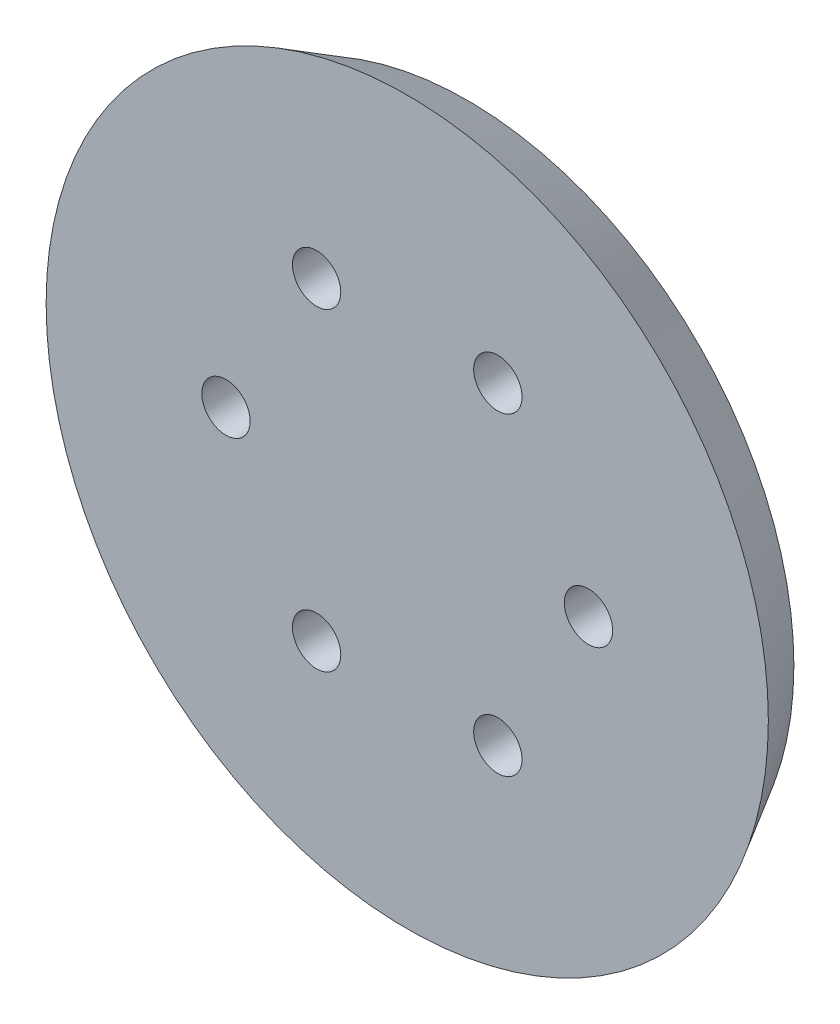
from build123d import *

# Parameters (mm, degrees)
SKETCH1_R           = 76.2
SKETCH1_R_2         = 5.08
BOSS_EXTRUDE1_DEPTH = 12.7
CHAMFER1_SIZE       = 13.198227154
CHAMFER1_SIZE_2     = 7.62
SKETCH3_R           = 5.08
BOSS_EXTRUDE2_DEPTH = 2.54
SKETCH4_R           = 4.064
BOSS_EXTRUDE3_DEPTH = 1.27
SKETCH5_R           = 4.572
BOSS_EXTRUDE4_DEPTH = 6.35


with BuildPart() as part:
    # Sketch1 → Boss-Extrude1 (new body)
    with BuildSketch(Plane.XY):
        Circle(SKETCH1_R)
        with Locations((38.1, 0)):
            Circle(SKETCH1_R_2, mode=Mode.SUBTRACT)
        with Locations((19.05, -32.995567884)):
            Circle(SKETCH1_R_2, mode=Mode.SUBTRACT)
        with Locations((-19.05, -32.995567884)):
            Circle(SKETCH1_R_2, mode=Mode.SUBTRACT)
        with Locations((-38.1, 0)):
            Circle(SKETCH1_R_2, mode=Mode.SUBTRACT)
        with Locations((-19.05, 32.995567884)):
            Circle(SKETCH1_R_2, mode=Mode.SUBTRACT)
        with Locations((19.05, 32.995567884)):
            Circle(SKETCH1_R_2, mode=Mode.SUBTRACT)
    extrude(amount=BOSS_EXTRUDE1_DEPTH)

    # Chamfer1
    # the kernel refuses this chamfer: 13.198227154, 7.62 mm, written as the material it takes off along each edge
    with BuildSketch(Plane(origin=(0, 0, 0), x_dir=(1, 0, 0), z_dir=(0, -1, 0))) as chamfer1_piece_1:
        Polygon((76.2, CHAMFER1_SIZE), (76.2 - CHAMFER1_SIZE_2, 0), (76.2, 0), align=None)
    revolve(axis=Axis((0, 0, 0), (0, 0, 1)), mode=Mode.SUBTRACT)

    # Sketch3 → Boss-Extrude2 (add)
    with BuildSketch(Plane(origin=(0, 0, 0), x_dir=(-1, 0, 0), z_dir=(0, 0, -1))):
        with Locations(Location((0, 0, 0), (0, 0, 180))):
            Circle(SKETCH3_R)
    extrude(amount=BOSS_EXTRUDE2_DEPTH)

    # Sketch4 → Boss-Extrude3 (add)
    with BuildSketch(Plane(origin=(0, 0, -2.54), x_dir=(-1, 0, 0), z_dir=(0, 0, -1))):
        Circle(SKETCH4_R)
    extrude(amount=BOSS_EXTRUDE3_DEPTH)

    # Sketch5 → Boss-Extrude4 (add)
    with BuildSketch(Plane(origin=(0, 0, -3.81), x_dir=(-1, 0, 0), z_dir=(0, 0, -1))):
        Circle(SKETCH5_R)
    extrude(amount=BOSS_EXTRUDE4_DEPTH)


solid = part.part
